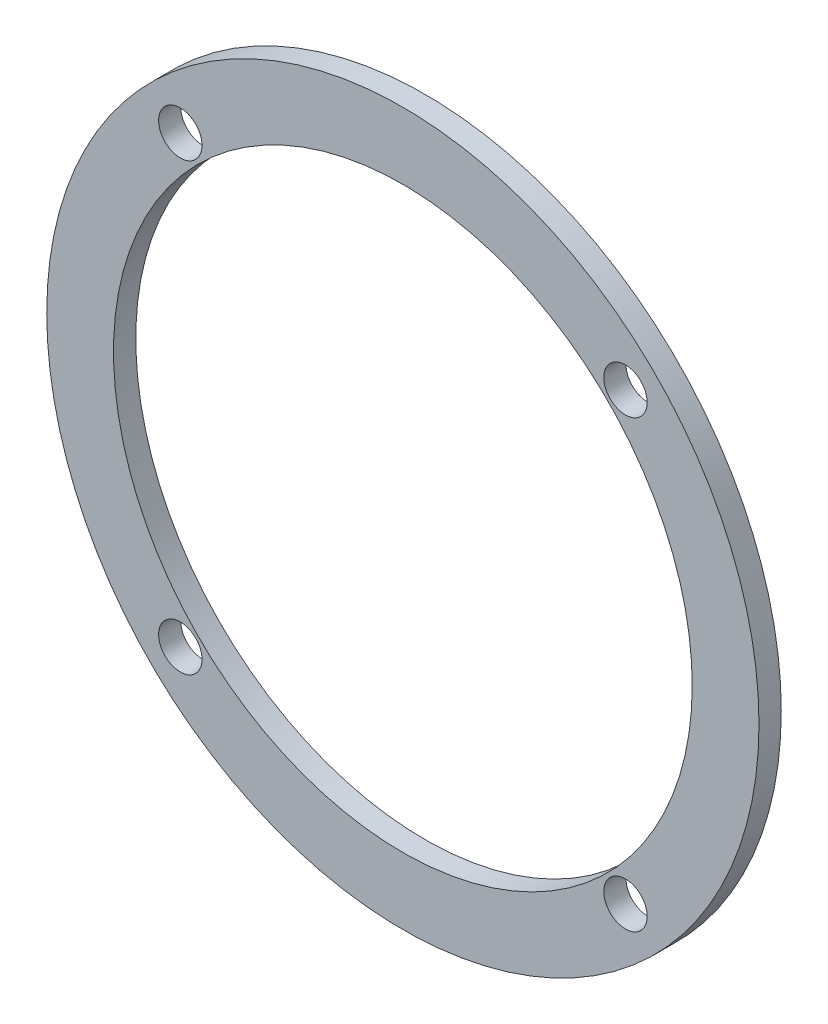
from build123d import *

# Parameters (mm, degrees)
SKETCH1_R           = 32
SKETCH1_R_2         = 1.95
SKETCH1_R_3         = 26
BOSS_EXTRUDE1_DEPTH = 2


with BuildPart() as part:
    # Sketch1 → Boss-Extrude1 (new body)
    with BuildSketch(Plane.XY):
        Circle(SKETCH1_R)
        with Locations((-20, -20)):
            Circle(SKETCH1_R_2, mode=Mode.SUBTRACT)
        with Locations((20, -20)):
            Circle(SKETCH1_R_2, mode=Mode.SUBTRACT)
        with Locations((-20, 20)):
            Circle(SKETCH1_R_2, mode=Mode.SUBTRACT)
        Circle(SKETCH1_R_3, mode=Mode.SUBTRACT)
        with Locations((20, 20)):
            Circle(SKETCH1_R_2, mode=Mode.SUBTRACT)
    extrude(amount=BOSS_EXTRUDE1_DEPTH)


solid = part.part
